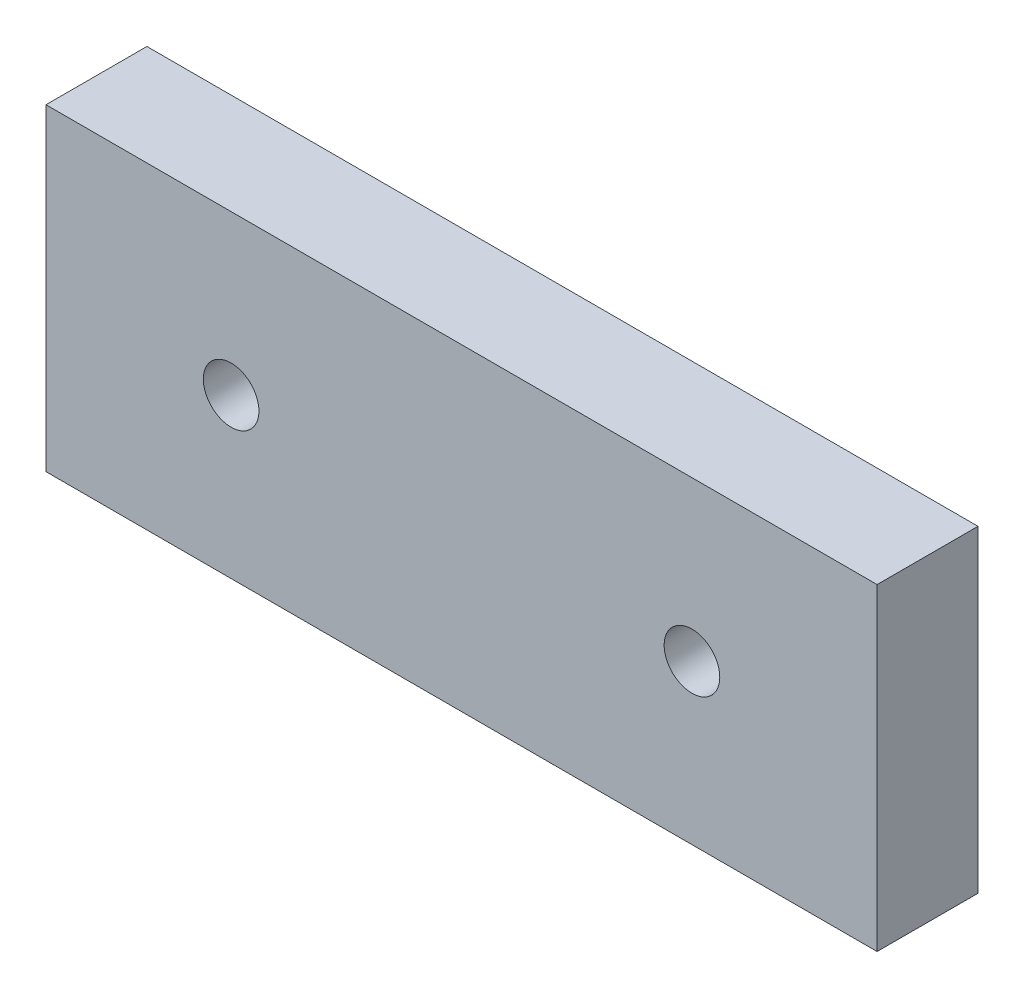
from build123d import *

# Parameters (mm, degrees)
SKETCH1_W           = 52.3
SKETCH1_H           = 20
SKETCH1_R           = 1.75
BOSS_EXTRUDE1_DEPTH = 6.35


with BuildPart() as part:
    # Sketch1 → Boss-Extrude1 (new body)
    with BuildSketch(Plane.XY):
        with Locations((26.15, 10)):
            Rectangle(SKETCH1_W, SKETCH1_H)
        with Locations((11.65, 10)):
            Circle(SKETCH1_R, mode=Mode.SUBTRACT)
        with Locations((40.65, 10)):
            Circle(SKETCH1_R, mode=Mode.SUBTRACT)
    extrude(amount=BOSS_EXTRUDE1_DEPTH)


solid = part.part
